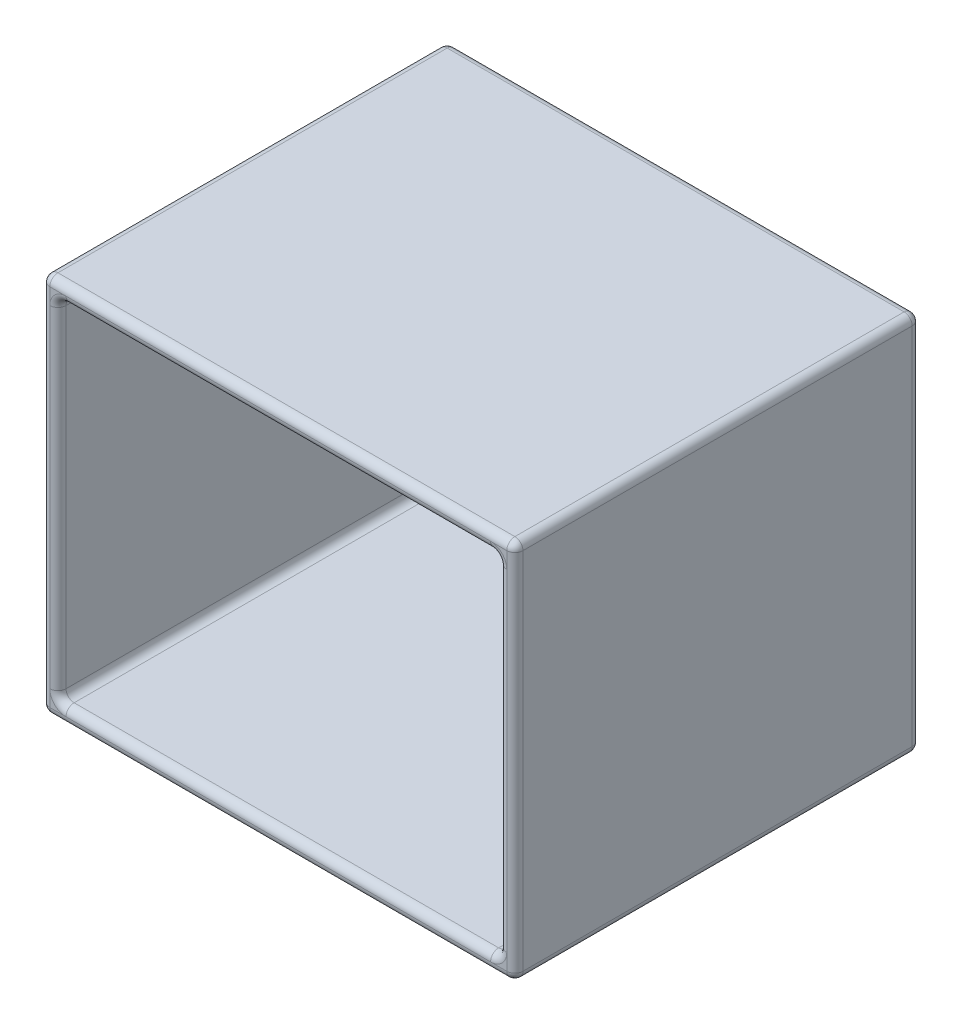
from build123d import *

# Parameters (mm, degrees)
CROQUIS1_W              = 291.78
CROQUIS1_H              = 234.63
CROQUIS1_W_2            = 271.78
CROQUIS1_H_2            = 214.63
SALIENTE_EXTRUIR1_DEPTH = 250
CROQUIS2_W              = 291.78
CROQUIS2_H              = 234.63
SALIENTE_EXTRUIR2_DEPTH = 10
REDONDEO1_R             = 5


with BuildPart() as part:
    # Croquis1 → Saliente-Extruir1 (new body)
    with BuildSketch(Plane.XY):
        Rectangle(CROQUIS1_W, CROQUIS1_H)
        Rectangle(CROQUIS1_W_2, CROQUIS1_H_2, mode=Mode.SUBTRACT)
    extrude(amount=SALIENTE_EXTRUIR1_DEPTH)

    # Croquis2 → Saliente-Extruir2 (add)
    with BuildSketch(Plane.XY):
        Rectangle(CROQUIS2_W, CROQUIS2_H)
    extrude(amount=SALIENTE_EXTRUIR2_DEPTH)

    # Redondeo1
    redondeo1_edges = [part.edges().sort_by_distance(p)[0] for p in [
        (145.89, 0, 250),
        (-135.89, 107.315, 130),
        (-135.89, -107.315, 130),
        (135.89, -107.315, 130),
        (135.89, 107.315, 130),
        (-135.89, 0, 250),
        (0, 117.315, 250),
        (0, -107.315, 250),
        (135.89, 0, 250),
        (0, 107.315, 250),
        (0, 107.315, 10),
        (-135.89, 0, 10),
        (0, -107.315, 10),
        (135.89, 0, 10),
        (-145.89, 0, 250),
        (0, 117.315, 0),
        (145.89, 0, 0),
        (0, -117.315, 0),
        (-145.89, 0, 0),
        (-145.89, 117.315, 125),
        (145.89, 117.315, 125),
        (145.89, -117.315, 125),
        (-145.89, -117.315, 125),
        (0, -117.315, 250),
    ]]
    fillet(redondeo1_edges, radius=REDONDEO1_R - 0.0001)  # a hair under: the kernel refuses the full size


solid = part.part
